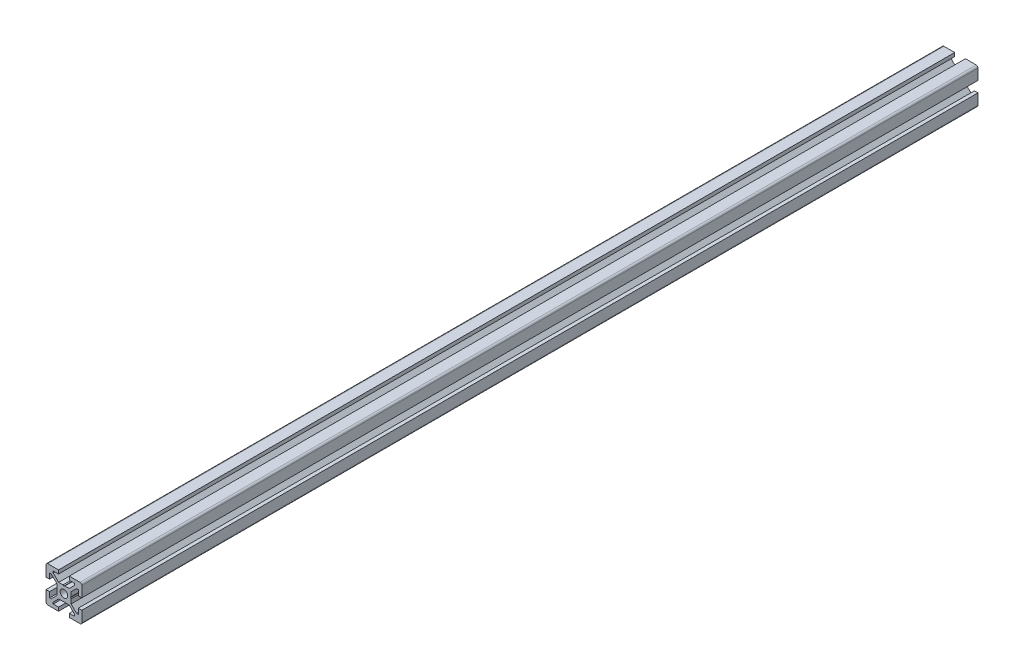
from build123d import *

# Parameters (mm, degrees)
BOSS_EXTRUDE1_DEPTH = 500
SKETCH2_W           = 500
SKETCH2_H           = 2.1


with BuildPart() as part:
    # Sketch1 → Boss-Extrude1 (new body)
    with BuildSketch(Plane.XY):
        with BuildLine():
            Line((-10, -3), (-10, -9))
            ThreePointArc((-10, -9), (-9.707106781, -9.707106781), (-9, -10))
            Line((-9, -10), (-3, -10))
            Line((-3, -10), (-3, -8))
            Line((-3, -8), (-6, -8))
            Line((-6, -8), (-6, -7.060660172))
            Line((-6, -7.060660172), (-2.939339828, -4))
            Line((-2.939339828, -4), (-0.519615242, -4))
            Line((-0.519615242, -4), (0, -3.7))
            Line((0, -3.7), (0.519615242, -4))
            Line((0.519615242, -4), (2.939339828, -4))
            Line((2.939339828, -4), (6, -7.060660172))
            Line((6, -7.060660172), (6, -8))
            Line((6, -8), (3, -8))
            Line((3, -8), (3, -10))
            Line((3, -10), (9, -10))
            ThreePointArc((9, -10), (9.707106781, -9.707106781), (10, -9))
            Line((10, -9), (10, -3))
            Line((10, -3), (8, -3))
            Line((8, -3), (8, -6))
            Line((8, -6), (7.060660172, -6))
            Line((7.060660172, -6), (4, -2.939339828))
            Line((4, -2.939339828), (4, -0.519615242))
            Line((4, -0.519615242), (3.7, 0))
            Line((3.7, 0), (4, 0.519615242))
            Line((4, 0.519615242), (4, 2.939339828))
            Line((4, 2.939339828), (7.060660172, 6))
            Line((7.060660172, 6), (8, 6))
            Line((8, 6), (8, 3))
            Line((8, 3), (10, 3))
            Line((10, 3), (10, 9))
            ThreePointArc((10, 9), (9.707106781, 9.707106781), (9, 10))
            Line((9, 10), (3, 10))
            Line((3, 10), (3, 8))
            Line((3, 8), (6, 8))
            Line((6, 8), (6, 7.060660172))
            Line((6, 7.060660172), (2.939339828, 4))
            Line((2.939339828, 4), (0.519615242, 4))
            Line((0.519615242, 4), (0, 3.7))
            Line((0, 3.7), (-0.519615242, 4))
            Line((-0.519615242, 4), (-2.939339828, 4))
            Line((-2.939339828, 4), (-6, 7.060660172))
            Line((-6, 7.060660172), (-6, 8))
            Line((-6, 8), (-3, 8))
            Line((-3, 8), (-3, 10))
            Line((-3, 10), (-9, 10))
            ThreePointArc((-9, 10), (-9.707106781, 9.707106781), (-10, 9))
            Line((-10, 9), (-10, 3))
            Line((-10, 3), (-8, 3))
            Line((-8, 3), (-8, 6))
            Line((-8, 6), (-7.060660172, 6))
            Line((-7.060660172, 6), (-4, 2.939339828))
            Line((-4, 2.939339828), (-4, 0.519615242))
            Line((-4, 0.519615242), (-3.7, 0))
            Line((-3.7, 0), (-4, -0.519615242))
            Line((-4, -0.519615242), (-4, -2.939339828))
            Line((-4, -2.939339828), (-7.060660172, -6))
            Line((-7.060660172, -6), (-8, -6))
            Line((-8, -6), (-8, -3))
            Line((-8, -3), (-10, -3))
        make_face()
    extrude(amount=-BOSS_EXTRUDE1_DEPTH)

    # Sketch2 → Cut-Revolve1 (revolve, cut)
    with BuildSketch(Plane(origin=(0, 0, 0), x_dir=(0, 0, -1), z_dir=(1, 0, 0))):
        with Locations((250, 1.05)):
            Rectangle(SKETCH2_W, SKETCH2_H)
    revolve(axis=Axis((0, 0, -500), (0, 0, 1)), mode=Mode.SUBTRACT)


solid = part.part
